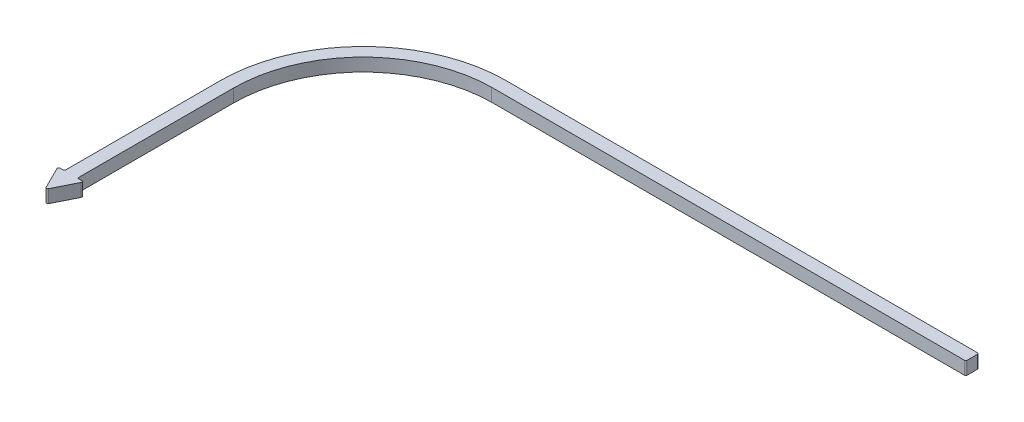
from build123d import *

# Parameters (mm, degrees)
BOSS_EXTRUDE1_DEPTH = 6.35
CUT_EXTRUDE1_DEPTH  = 341.219392139
FILLET1_R           = 0.635


with BuildPart() as part:
    # Sketch1 → Boss-Extrude1 (new body)
    with BuildSketch(Plane(origin=(0, 0, 0), x_dir=(1, 0, 0), z_dir=(0, 1, 0))):
        with BuildLine():
            Line((300.846682845, 158.745663591), (69.071682845, 158.745663591))
            ThreePointArc((69.071682845, 158.745663591), (20.184176976, 138.015461144), (0, 88.9))
            Line((0, 88.9), (0, 12.7))
            Line((0, 12.7), (-3.175, 12.7))
            Line((-3.175, 12.7), (-3.175, 0))
            Line((-3.175, 0), (9.525, 0))
            Line((9.525, 0), (9.525, 12.7))
            Line((9.525, 12.7), (6.35, 12.7))
            Line((6.35, 12.7), (6.35, 88.9))
            ThreePointArc((6.35, 88.9), (24.674380805, 133.525255521), (69.071682845, 152.395229919))
            Line((69.071682845, 152.395229919), (300.846682845, 152.395229919))
            Line((300.846682845, 152.395229919), (300.846682845, 158.745663591))
        make_face()
    extrude(amount=BOSS_EXTRUDE1_DEPTH)

    # Sketch2 → Cut-Extrude1 (cut, through all)
    with BuildSketch(Plane(origin=(0, 6.35, 0), x_dir=(1, 0, 0), z_dir=(0, 1, 0))):
        Polygon((3.175, 0), (-3.175, 12.7), (-3.175, 0), align=None)
        Polygon((9.525, 12.7), (3.175, 0), (9.525, 0), align=None)
    extrude(amount=-CUT_EXTRUDE1_DEPTH, mode=Mode.SUBTRACT)

    # Fillet1
    fillet1_edges = [part.edges().sort_by_distance(p)[0] for p in [
        (300.846682845, 3.175, -158.745663591),
        (300.846682845, 3.175, -152.395229919),
        (6.35, 3.175, -12.7),
        (0, 3.175, -12.7),
        (-3.175, 3.175, -12.7),
        (9.525, 3.175, -12.7),
        (3.175, 3.175, 0),
    ]]
    fillet(fillet1_edges, radius=FILLET1_R)


solid = part.part
